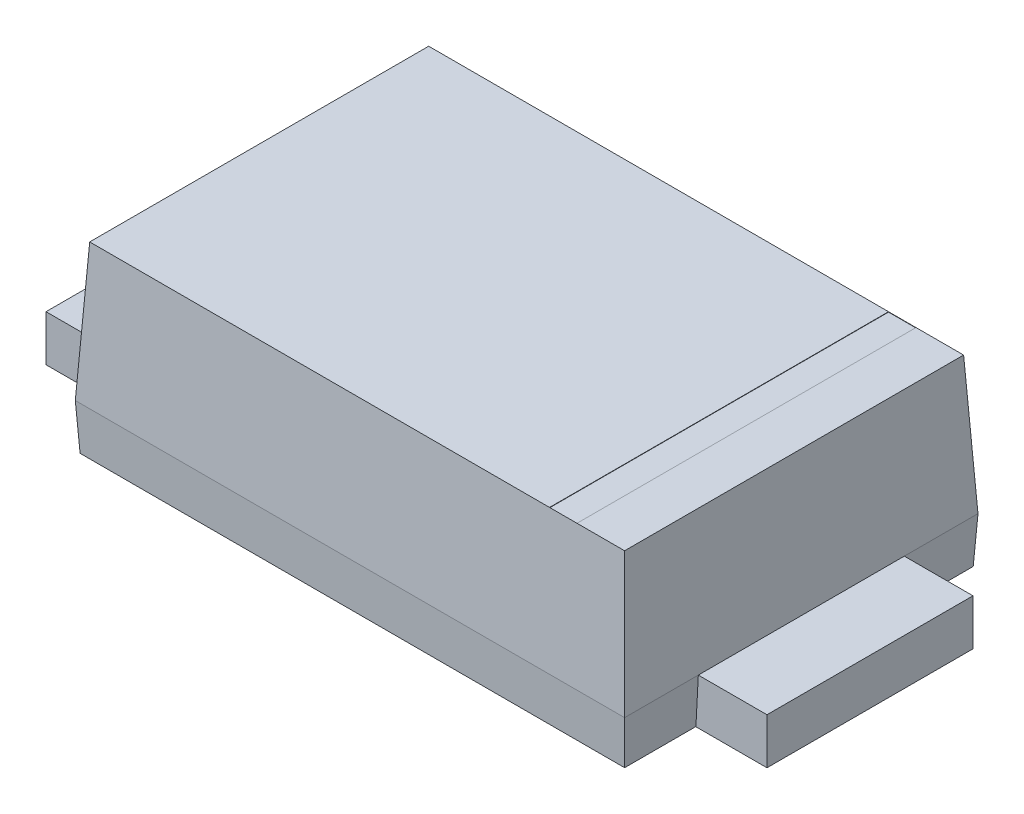
from build123d import *

# Parameters (mm, degrees)
SKETCH1_W                = 3
SKETCH1_H                = 1.93
BOSS_EXTRUDE1_DEPTH      = 0.75
BOSS_EXTRUDE1_TAPER      = 3
SKETCH5_W                = 3
SKETCH5_H                = 1.93
BOSS_EXTRUDE3_DEPTH      = 0.25
BOSS_EXTRUDE3_TAPER      = 3
BOSS_EXTRUDE4_DEPTH      = 0.001
BOSS_EXTRUDE4_DEPTH_BACK = 0.25
SKETCH6_W                = 0.775
SKETCH6_H                = 1.25
SKETCH7_W                = 0.15
SKETCH7_H                = 1.851388332
CUT_EXTRUDE1_DEPTH       = 0.002


with BuildPart() as part:
    # Sketch1 → Boss-Extrude1 (new body)
    with BuildSketch(Plane(origin=(0, 0.25, 0), x_dir=(1, 0, 0), z_dir=(0, 1, 0))):
        Rectangle(SKETCH1_W, SKETCH1_H)
    extrude(amount=BOSS_EXTRUDE1_DEPTH, taper=BOSS_EXTRUDE1_TAPER)

    # Sketch5 → Boss-Extrude3 (add)
    with BuildSketch(Plane.XZ.offset(-0.25)):
        Rectangle(SKETCH5_W, SKETCH5_H)
    extrude(amount=BOSS_EXTRUDE3_DEPTH, taper=BOSS_EXTRUDE3_TAPER)

    # Sketch6 → Boss-Extrude4 (add, two sides: drawn at the far end of the back side and taken through both)
    with BuildSketch(Plane.XZ.offset(-BOSS_EXTRUDE4_DEPTH_BACK)):
        Polygon((0.025, -0.625), (1.225, -0.625), (1.225, -0.5625), (1.875, -0.5625), (1.875, 0.5625), (1.225, 0.5625), (1.225, 0.625), (0.025, 0.625), align=None)
        with Locations((-1.6125, 0)):
            Rectangle(SKETCH6_W, SKETCH6_H)
    extrude(amount=BOSS_EXTRUDE4_DEPTH + BOSS_EXTRUDE4_DEPTH_BACK)

    # Sketch7 → Cut-Extrude1 (cut)
    with BuildSketch(Plane(origin=(0, 1, 0), x_dir=(1, 0, 0), z_dir=(0, 1, 0))):
        with Locations((1.125694166, 0)):
            Rectangle(SKETCH7_W, SKETCH7_H)
    extrude(amount=-CUT_EXTRUDE1_DEPTH, mode=Mode.SUBTRACT)


solid = part.part
